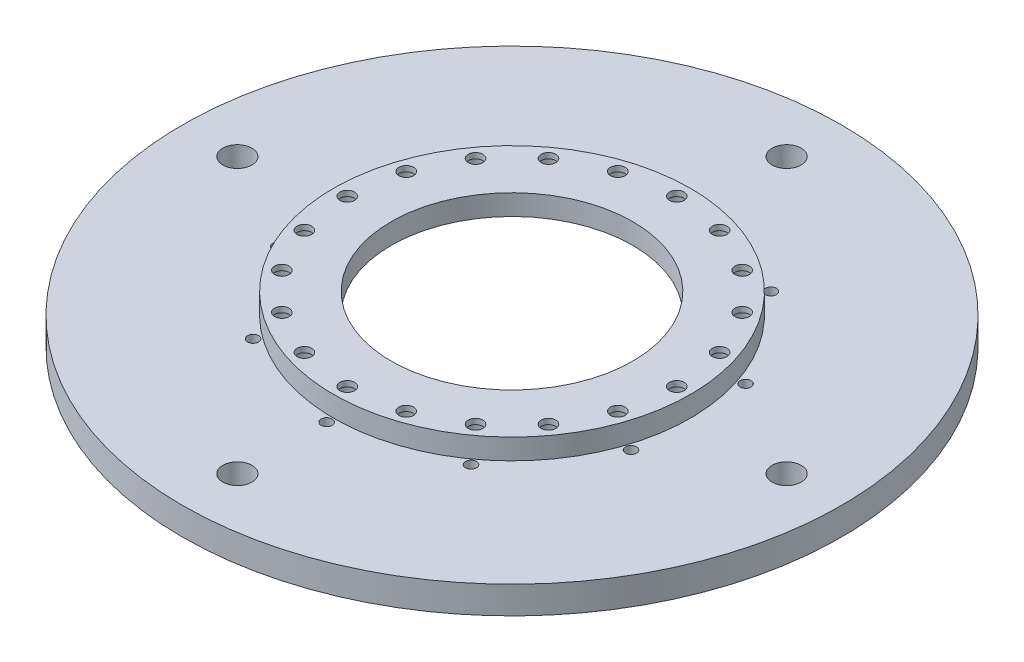
from build123d import *

# Parameters (mm, degrees)
SKETCH9_R                           = 82.55
SKETCH9_R_2                         = 55.88
REF_BACKPLATE_DEPTH                 = 9.525
REF_CBORE_BACKPLATE_D               = 6.7564
REF_CBORE_BACKPLATE_CBORE_D         = 11.176
REF_CBORE_BACKPLATE_CBORE_DEPTH     = 6.985
REF_CBORE_BACKPLATE_PATTERN_COUNT   = 20
SKETCH1_R                           = 152.4
SKETCH1_R_2                         = 79.375
THRUSTPLATE_TC3_DEPTH               = 12.7
SKETCH12_W                          = 6.74624
SKETCH12_H                          = 12.7
CLEARANCE_THRUSTPLATE_PATTERN_COUNT = 4
SKETCH23_W                          = 2.5527
SKETCH23_H                          = 12.7
CIRPATTERN1_COUNT                   = 10


with BuildPart() as part:
    # Sketch9 → REF_BackPlate (new body)
    with BuildSketch(Plane(origin=(0, 0, 0), x_dir=(1, 0, 0), z_dir=(0, 1, 0))):
        Circle(SKETCH9_R)
        Circle(SKETCH9_R_2, mode=Mode.SUBTRACT)
    extrude(amount=REF_BACKPLATE_DEPTH)

    # REF_CBORE_BackPlate (through all)
    with Locations(Plane(origin=(0, 0, 0), x_dir=(-1, 0, 0), z_dir=(0, -1, 0))):
        with Locations((0, 76.2)):
            ref_cbore_backplate = CounterBoreHole(REF_CBORE_BACKPLATE_D / 2, REF_CBORE_BACKPLATE_CBORE_D / 2, REF_CBORE_BACKPLATE_CBORE_DEPTH)

    # REF_CBORE_BackPlate_Pattern: REF_CBORE_BackPlate ×20 about axis
    ref_cbore_backplate_pattern_axis = Axis((0, 9.525, 0), (0, -1, 0))
    for i in range(1, REF_CBORE_BACKPLATE_PATTERN_COUNT):
        add(ref_cbore_backplate.rotate(ref_cbore_backplate_pattern_axis, i * 360 / REF_CBORE_BACKPLATE_PATTERN_COUNT), mode=Mode.SUBTRACT)


with BuildPart() as body_2:
    # Sketch1 → ThrustPlate_TC3 (new body)
    with BuildSketch(Plane(origin=(0, 0, 0), x_dir=(1, 0, 0), z_dir=(0, 1, 0))):
        Circle(SKETCH1_R)
        Circle(SKETCH1_R_2, mode=Mode.SUBTRACT)
    extrude(amount=-THRUSTPLATE_TC3_DEPTH)

    # Sketch12 → UNDEF_Clearance_ThrustPlate (revolve, cut)
    with BuildSketch(Plane(origin=(0, 0, -127), x_dir=(0, 0, 1), z_dir=(1, 0, 0))):
        with Locations((3.37312, 6.35)):
            Rectangle(SKETCH12_W, SKETCH12_H)
    undef_clearance_thrustplate = revolve(axis=Axis((0, 6.35, -127), (0, -1, 0)), mode=Mode.SUBTRACT)

    # Clearance_ThrustPlate_Pattern: UNDEF_Clearance_ThrustPlate ×4 about axis
    clearance_thrustplate_pattern_axis = Axis((0, -12.7, 0), (0, 1, 0))
    for i in range(1, CLEARANCE_THRUSTPLATE_PATTERN_COUNT):
        add(undef_clearance_thrustplate.rotate(clearance_thrustplate_pattern_axis, i * 360 / CLEARANCE_THRUSTPLATE_PATTERN_COUNT), mode=Mode.SUBTRACT)

    # Sketch23 → #10 Clearance Hole1 (revolve, cut)
    with BuildSketch(Plane(origin=(0, 0, -85.725), x_dir=(0, 0, 1), z_dir=(1, 0, 0))):
        with Locations((1.27635, 6.35)):
            Rectangle(SKETCH23_W, SKETCH23_H)
    f_10_clearance_hole1 = revolve(axis=Axis((0, 6.35, -85.725), (0, -1, 0)), mode=Mode.SUBTRACT)

    # CirPattern1: #10 Clearance Hole1 ×10 about axis
    cirpattern1_axis = Axis((0, -12.7, 0), (0, 1, 0))
    for i in range(1, CIRPATTERN1_COUNT):
        add(f_10_clearance_hole1.rotate(cirpattern1_axis, i * 360 / CIRPATTERN1_COUNT), mode=Mode.SUBTRACT)


solid = Compound([part.part, body_2.part])
